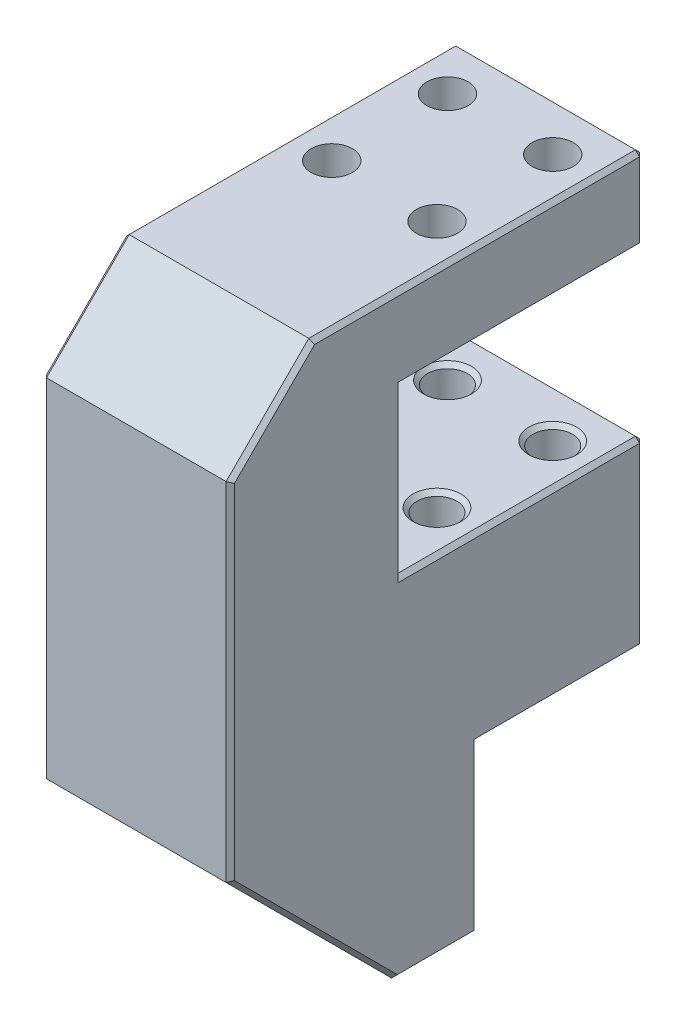
from build123d import *

# Parameters (mm, degrees)
SKETCH2_W                      = 22.73
SKETCH2_H                      = 30
BOSS_EXTRUDE1_DEPTH            = 52
SKETCH3_W                      = 22.73
SKETCH3_H                      = 10
BOSS_EXTRUDE2_DEPTH            = 20
CBORE_FOR_M5_SHCS1_D           = 5.5
CBORE_FOR_M5_SHCS1_CBORE_D     = 10
CBORE_FOR_M5_SHCS1_CBORE_DEPTH = 5
BOSS_EXTRUDE3_START            = 20
SKETCH7_W                      = 22.73
SKETCH7_H                      = 72
SKETCH7_R                      = 5
BOSS_EXTRUDE3_DEPTH            = 20
SKETCH8_W                      = 29.2
SKETCH8_H                      = 20
CUT_EXTRUDE1_DEPTH             = 65.192311845
CUT_EXTRUDE2_REACH             = 81.99
SKETCH9_R                      = 2.5
SKETCH10_R                     = 2.4
CUT_EXTRUDE3_DEPTH             = 20
SKETCH12_W                     = 20
SKETCH12_H                     = 22
BOSS_EXTRUDE5_DEPTH            = 20
CBORE_FOR_M5_SHCS2_D           = 5.5
CBORE_FOR_M5_SHCS2_CBORE_D     = 10
CBORE_FOR_M5_SHCS2_CBORE_DEPTH = 16
CHAMFER1_SIZE                  = 20
CHAMFER3_SIZE                  = 10
CHAMFER2_SIZE                  = 0.5


with BuildPart() as part:
    # Sketch2 → Boss-Extrude1 (new body)
    with BuildSketch(Plane(origin=(0, 0, 0), x_dir=(1, 0, 0), z_dir=(0, 1, 0))):
        with Locations((-6.365, 5)):
            Rectangle(SKETCH2_W, SKETCH2_H)
    extrude(amount=BOSS_EXTRUDE1_DEPTH)

    # Sketch3 → Boss-Extrude2 (add)
    with BuildSketch(Plane.XZ):
        with Locations((-6.365, 5)):
            Rectangle(SKETCH3_W, SKETCH3_H)
    extrude(amount=BOSS_EXTRUDE2_DEPTH)

    # CBORE for M5 SHCS1 (through all)
    with Locations(Plane.XY.offset(10)):
        with Locations((-6.365, -10)):
            CounterBoreHole(CBORE_FOR_M5_SHCS1_D / 2, CBORE_FOR_M5_SHCS1_CBORE_D / 2, CBORE_FOR_M5_SHCS1_CBORE_DEPTH)

    # Sketch7 → Boss-Extrude3 (add)
    with BuildSketch(Plane.XY.offset(10).offset(BOSS_EXTRUDE3_START)):
        with Locations((-6.365, 16)):
            Rectangle(SKETCH7_W, SKETCH7_H)
        with Locations((-6.365, -10)):
            Circle(SKETCH7_R, mode=Mode.SUBTRACT)
    extrude(amount=-BOSS_EXTRUDE3_DEPTH)

    # Sketch8 → Cut-Extrude1 (cut, through all)
    with BuildSketch(Plane(origin=(5, 0, 0), x_dir=(0, 0, -1), z_dir=(1, 0, 0))):
        with Locations((5.4, 32)):
            Rectangle(SKETCH8_W, SKETCH8_H)
    extrude(amount=-CUT_EXTRUDE1_DEPTH, mode=Mode.SUBTRACT)

    # Sketch9 → Cut-Extrude2 (cut, up to next)
    with BuildSketch(Plane(origin=(0, 52, 0), x_dir=(1, 0, 0), z_dir=(0, 1, 0)), mode=Mode.PRIVATE) as cut_extrude2_sk1:
        with Locations(Location((-12.73, 0, 0), (0, 0, 270))):
            Circle(SKETCH9_R)
    cut_extrude2_tool1 = extrude(cut_extrude2_sk1.sketch, amount=-CUT_EXTRUDE2_REACH, mode=Mode.PRIVATE) & part.part
    # Sketch9 → Cut-Extrude2 (cut, up to next)
    with BuildSketch(Plane(origin=(0, 52, 0), x_dir=(1, 0, 0), z_dir=(0, 1, 0)), mode=Mode.PRIVATE) as cut_extrude2_sk2:
        with Locations(Location((0, 14, 0), (0, 0, 270))):
            Circle(SKETCH9_R)
    cut_extrude2_tool2 = extrude(cut_extrude2_sk2.sketch, amount=-CUT_EXTRUDE2_REACH, mode=Mode.PRIVATE) & part.part
    # Sketch9 → Cut-Extrude2 (cut, up to next)
    with BuildSketch(Plane(origin=(0, 52, 0), x_dir=(1, 0, 0), z_dir=(0, 1, 0)), mode=Mode.PRIVATE) as cut_extrude2_sk3:
        with Locations(Location((-12.73, 14, 0), (0, 0, 270))):
            Circle(SKETCH9_R)
    cut_extrude2_tool3 = extrude(cut_extrude2_sk3.sketch, amount=-CUT_EXTRUDE2_REACH, mode=Mode.PRIVATE) & part.part
    # Sketch9 → Cut-Extrude2 (cut, up to next)
    with BuildSketch(Plane(origin=(0, 52, 0), x_dir=(1, 0, 0), z_dir=(0, 1, 0)), mode=Mode.PRIVATE) as cut_extrude2_sk4:
        with Locations(Location((0, 0, 0), (0, 0, 270))):
            Circle(SKETCH9_R)
    cut_extrude2_tool4 = extrude(cut_extrude2_sk4.sketch, amount=-CUT_EXTRUDE2_REACH, mode=Mode.PRIVATE) & part.part
    add(cut_extrude2_tool1.solids().sort_by_distance((-12.73, 52, 0))[0], mode=Mode.SUBTRACT)
    add(cut_extrude2_tool2.solids().sort_by_distance((0, 52, -14))[0], mode=Mode.SUBTRACT)
    add(cut_extrude2_tool3.solids().sort_by_distance((-12.73, 52, -14))[0], mode=Mode.SUBTRACT)
    add(cut_extrude2_tool4.solids().sort_by_distance((0, 52, 0))[0], mode=Mode.SUBTRACT)

    # Sketch10 → Cut-Extrude3 (cut)
    with BuildSketch(Plane(origin=(0, 22, 0), x_dir=(1, 0, 0), z_dir=(0, 1, 0))):
        with Locations(Location((0, 0, 0), (0, 0, 270))):
            Circle(SKETCH10_R)
        with Locations(Location((-12.73, 0, 0), (0, 0, 270))):
            Circle(SKETCH10_R)
        with Locations(Location((-12.73, 14, 0), (0, 0, 270))):
            Circle(SKETCH10_R)
        with Locations(Location((0, 14, 0), (0, 0, 270))):
            Circle(SKETCH10_R)
    extrude(amount=-CUT_EXTRUDE3_DEPTH, mode=Mode.SUBTRACT)

    # Sketch12 → Boss-Extrude5 (add)
    with BuildSketch(Plane(origin=(0, 0, -20), x_dir=(-1, 0, 0), z_dir=(0, 0, -1))):
        with Locations((27.73, 11)):
            Rectangle(SKETCH12_W, SKETCH12_H)
    extrude(amount=-BOSS_EXTRUDE5_DEPTH)

    # CBORE for M5 SHCS2 (through all)
    with Locations(Plane(origin=(0, 22, 0), x_dir=(1, 0, 0), z_dir=(0, 1, 0))):
        with Locations((-27.73, 10)):
            CounterBoreHole(CBORE_FOR_M5_SHCS2_D / 2, CBORE_FOR_M5_SHCS2_CBORE_D / 2, CBORE_FOR_M5_SHCS2_CBORE_DEPTH)

    # Chamfer1
    # the kernel refuses this chamfer: 20 mm, written as the material it takes off along each edge
    with BuildSketch(Plane(origin=(-69.163659759, -20, 30), x_dir=(0, 0.9996219169112968, 0.027495876610586317), z_dir=(1, 0, 0))) as chamfer1_piece_1:
        Polygon((CHAMFER1_SIZE * 0.999621916911, -CHAMFER1_SIZE * 0.0274958766106), (-CHAMFER1_SIZE * 0.0274958766106, -CHAMFER1_SIZE * 0.999621916911), (0, 0), align=None)
    extrude(amount=125.597319519, mode=Mode.SUBTRACT)
    with BuildSketch(Plane(origin=(-37.73, 22, -71.433659759), x_dir=(0.9996219169112968, 0.027495876610586317, 0), z_dir=(0, 0, 1))) as chamfer1_piece_2:
        Polygon((CHAMFER1_SIZE * 0.999621916911, -CHAMFER1_SIZE * 0.0274958766106), (-CHAMFER1_SIZE * 0.0274958766106, -CHAMFER1_SIZE * 0.999621916911), (0, 0), align=None)
    extrude(amount=122.867319519, mode=Mode.SUBTRACT)

    # Chamfer3
    chamfer3_edges = [part.edges().sort_by_distance(p)[0] for p in [
        (-6.365, 52, 30),
    ]]
    chamfer(chamfer3_edges, length=CHAMFER3_SIZE)

    # Chamfer2
    chamfer2_edges = [part.edges().sort_by_distance(p)[0] for p in [
        (5, 52, 0),
        (5, 11, -20),
        (5, 47, -20),
        (5, 0, -10),
        (5, -10, 0),
        (5, -20, 5),
        (5, -10, 20),
        (5, 21, 30),
        (-17.73, -10, 0),
        (-17.73, 47, -20),
        (-17.73, 52, 0),
        (-17.73, 21, 30),
        (-17.73, -10, 20),
        (-17.73, -20, 5),
        (5, 42, -5.4),
        (5, 32, 9.2),
        (5, 22, -5.4),
        (-17.73, 22, 4.6),
        (-17.73, 32, 9.2),
        (-17.73, 42, -5.4),
        (0, 22, -16.4),
        (-12.73, 22, -16.4),
        (-12.73, 22, -2.4),
        (0, 22, -2.4),
        (5, 47, 25),
        (-17.73, 47, 25),
        (-37.73, 1, -20),
        (-27.73, 12, -20),
        (-6.365, 22, -20),
        (-6.365, 42, -20),
        (-6.365, 52, -20),
    ]]
    chamfer(chamfer2_edges, length=CHAMFER2_SIZE)


solid = part.part
